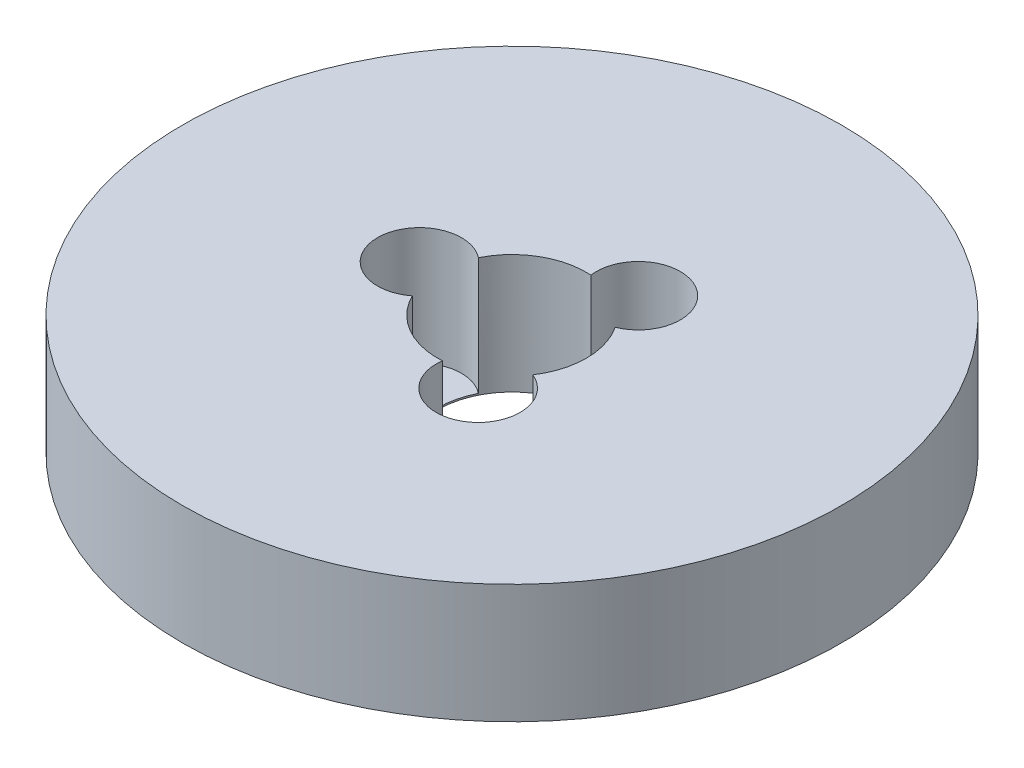
from build123d import *

# Parameters (mm, degrees)
SKETCH1_R           = 77.5
BOSS_EXTRUDE1_DEPTH = 28
SKETCH2_R           = 17.5
CUT_EXTRUDE1_DEPTH  = 114.121615971
SKETCH3_R           = 9.871245717
CUT_EXTRUDE2_DEPTH  = 27.626170215
CIRPATTERN1_COUNT   = 3


with BuildPart() as part:
    # Sketch1 → Boss-Extrude1 (new body)
    with BuildSketch(Plane(origin=(0, 0, 0), x_dir=(1, 0, 0), z_dir=(0, 1, 0))):
        Circle(SKETCH1_R)
    extrude(amount=BOSS_EXTRUDE1_DEPTH)

    # Sketch2 → Cut-Extrude1 (cut, through all)
    with BuildSketch(Plane(origin=(0, 0, 0), x_dir=(1, 0, 0), z_dir=(0, 1, 0))):
        Circle(SKETCH2_R)
    extrude(amount=CUT_EXTRUDE1_DEPTH, mode=Mode.SUBTRACT)

    # Sketch3 → Cut-Extrude2 (cut)
    with BuildSketch(Plane(origin=(0, 28, 0), x_dir=(1, 0, 0), z_dir=(0, 1, 0))):
        with Locations((-21.753864026, 0)):
            Circle(SKETCH3_R)
    cut_extrude2 = extrude(amount=-CUT_EXTRUDE2_DEPTH, mode=Mode.SUBTRACT)

    # CirPattern1: Cut-Extrude2 ×3 about axis
    cirpattern1_axis = Axis((0, 0, 0), (0, 1, 0))
    for i in range(1, CIRPATTERN1_COUNT):
        add(cut_extrude2.rotate(cirpattern1_axis, i * 360 / CIRPATTERN1_COUNT), mode=Mode.SUBTRACT)


solid = part.part
